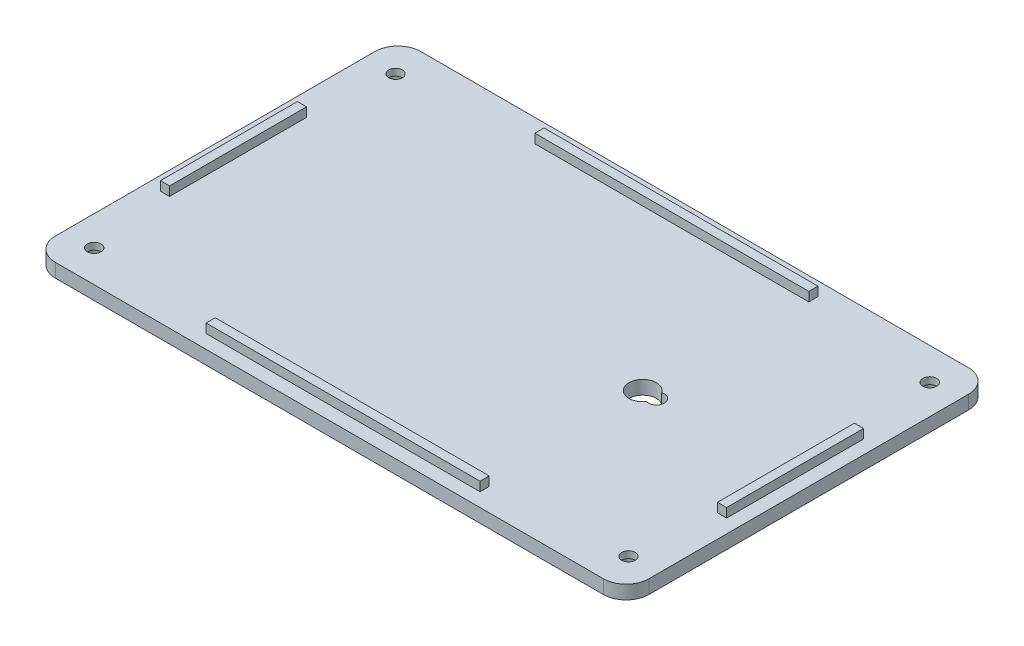
from build123d import *

# Parameters (mm, degrees)
EXTRUDE_1_DEPTH     = 3
CUT_EXTRUDE_2_DEPTH = 15
SKETCH_8_R          = 1.5
CUT_EXTRUDE_3_DEPTH = 10
SKETCH_9_R          = 2.5
CUT_EXTRUDE_4_DEPTH = 1.5
SKETCH_10_W         = 2
SKETCH_10_H         = 30
SKETCH_10_W_2       = 60
SKETCH_10_H_2       = 2
EXTRUDE_2_DEPTH     = 2


with BuildPart() as part:
    # Эскиз1 → Бобышка-Вытянуть1 (new body)
    with BuildSketch(Plane(origin=(0, 0, 0), x_dir=(1, 0, 0), z_dir=(0, 1, 0))):
        with BuildLine():
            Line((-60, 40), (60, 40))
            ThreePointArc((60, 40), (63.535533906, 38.535533906), (65, 35))
            Line((65, 35), (65, -35))
            ThreePointArc((65, -35), (63.535533906, -38.535533906), (60, -40))
            Line((60, -40), (-60, -40))
            ThreePointArc((-60, -40), (-63.535533906, -38.535533906), (-65, -35))
            Line((-65, -35), (-65, 35))
            ThreePointArc((-65, 35), (-63.535533906, 38.535533906), (-60, 40))
        make_face()
    extrude(amount=EXTRUDE_1_DEPTH)

    # Эскиз7 → Вырез-Вытянуть2 (cut)
    with BuildSketch(Plane.XZ):
        with BuildLine():
            ThreePointArc((31.112033157, 1.673910041), (25.622449823, 0), (31.112033157, -1.673910041))
            ThreePointArc((31.112033157, -1.673910041), (33.372449823, 0), (31.112033157, 1.673910041))
        make_face()
    extrude(amount=-CUT_EXTRUDE_2_DEPTH, mode=Mode.SUBTRACT)

    # Эскиз8 → Вырез-Вытянуть3 (cut)
    with BuildSketch(Plane(origin=(0, 3, 0), x_dir=(1, 0, 0), z_dir=(0, 1, 0))):
        with Locations((-58.5, 33)):
            Circle(SKETCH_8_R)
        with Locations((58.5, 33)):
            Circle(SKETCH_8_R)
        with Locations((58.5, -33)):
            Circle(SKETCH_8_R)
        with Locations((-58.5, -33)):
            Circle(SKETCH_8_R)
    extrude(amount=-CUT_EXTRUDE_3_DEPTH, mode=Mode.SUBTRACT)

    # Эскиз9 → Вырез-Вытянуть4 (cut)
    with BuildSketch(Plane.XZ):
        with Locations((-58.5, 33)):
            Circle(SKETCH_9_R)
        with Locations((58.5, 33)):
            Circle(SKETCH_9_R)
        with Locations((58.5, -33)):
            Circle(SKETCH_9_R)
        with Locations((-58.5, -33)):
            Circle(SKETCH_9_R)
    extrude(amount=-CUT_EXTRUDE_4_DEPTH, mode=Mode.SUBTRACT)

    # Эскиз10 → Бобышка-Вытянуть2 (add)
    with BuildSketch(Plane(origin=(0, 3, 0), x_dir=(1, 0, 0), z_dir=(0, 1, 0))):
        with Locations((-61, 0)):
            Rectangle(SKETCH_10_W, SKETCH_10_H)
        with Locations((0, 36)):
            Rectangle(SKETCH_10_W_2, SKETCH_10_H_2)
        with Locations((0, -36)):
            Rectangle(SKETCH_10_W_2, SKETCH_10_H_2)
        with Locations((61, 0)):
            Rectangle(SKETCH_10_W, SKETCH_10_H)
    extrude(amount=EXTRUDE_2_DEPTH)


solid = part.part
